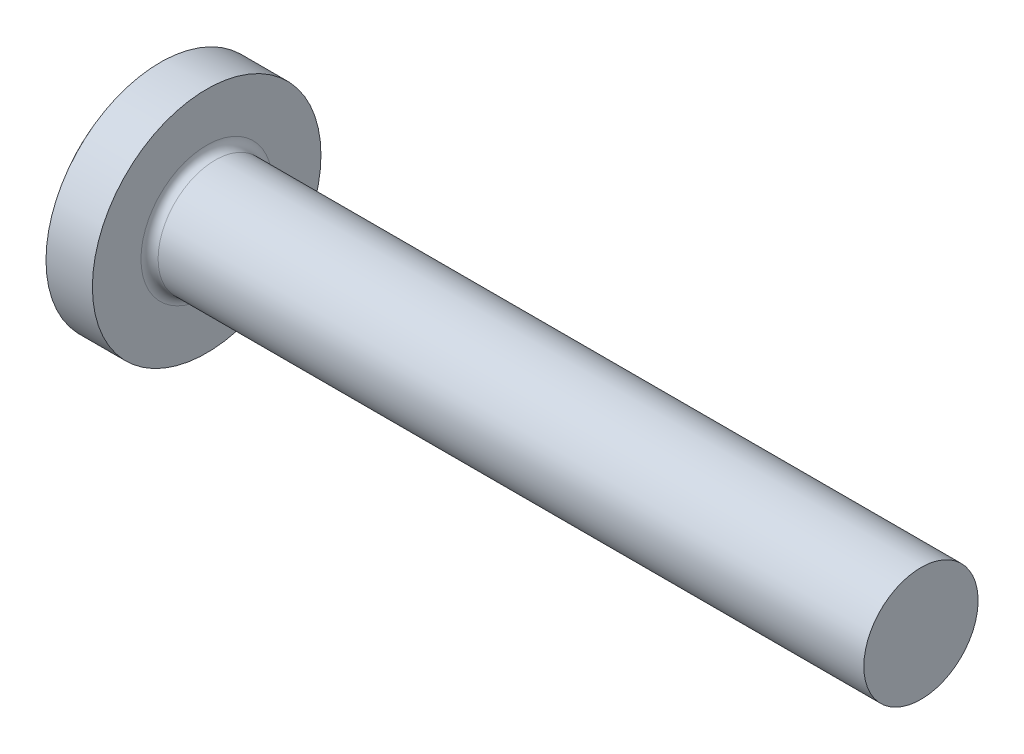
from build123d import *

# Parameters (mm, degrees)
FILLET1_R    = 0.6
RECPAT_COUNT = 2
RECPAT_ANGLE = 90


with BuildPart() as part:
    # BodySke → BaseBody (revolve)
    with BuildSketch(Plane.XY):
        with BuildLine():
            Line((6, 4), (6, 8))
            Line((6, 8), (2.753049234, 8))
            ThreePointArc((2.753049234, 8), (0.707515305, 4.230226947), (0, 0))
            Line((0, 0), (56, 0))
            Line((56, 0), (56, 4))
            Line((56, 4), (6, 4))
        make_face()
    revolve(axis=Axis((0, 0, 0), (1, 0, 0)))

    # Fillet1
    fillet1_edges = [part.edges().sort_by_distance(p)[0] for p in [
        (6, -4, 0),
    ]]
    fillet(fillet1_edges, radius=FILLET1_R)

    # RecSkeTop → Recess section 0
    with BuildSketch(Plane(origin=(0, 0, 0), x_dir=(0, 0, -1), z_dir=(1, 0, 0))):
        with BuildLine():
            Line((-0.968, 4.4), (0.968, 4.4))
            Line((0.968, 4.4), (0.968, -4.4))
            Line((0.968, -4.4), (-0.968, -4.4))
            Line((-0.968, -4.4), (-0.968, 4.4))
        make_face()
    # RecSkeBot → Recess section 1
    with BuildSketch(Plane(origin=(4.5, 0, 0), x_dir=(0, 0, -1), z_dir=(1, 0, 0))):
        with BuildLine():
            Line((-0.968, 2.156383139), (0.968, 2.156383139))
            Line((0.968, 2.156383139), (0.968, -2.156383139))
            Line((0.968, -2.156383139), (-0.968, -2.156383139))
            Line((-0.968, -2.156383139), (-0.968, 2.156383139))
        make_face()
    recess = loft(mode=Mode.SUBTRACT)

    # RecPat: Recess ×2 about axis
    recpat_axis = Axis((0, 0, 0), (1, 0, 0))
    for i in range(1, RECPAT_COUNT):
        add(recess.rotate(recpat_axis, i * RECPAT_ANGLE / (RECPAT_COUNT - 1)), mode=Mode.SUBTRACT)

    # RecCorSke → RecessCore (revolve, cut)
    with BuildSketch(Plane.XY):
        Polygon((0, 0), (0, 2.1296), (4.5, 1.814929346), (5.089706292, 0), align=None)
    revolve(axis=Axis((0, 0, 0), (1, 0, 0)), mode=Mode.SUBTRACT)


solid = part.part
